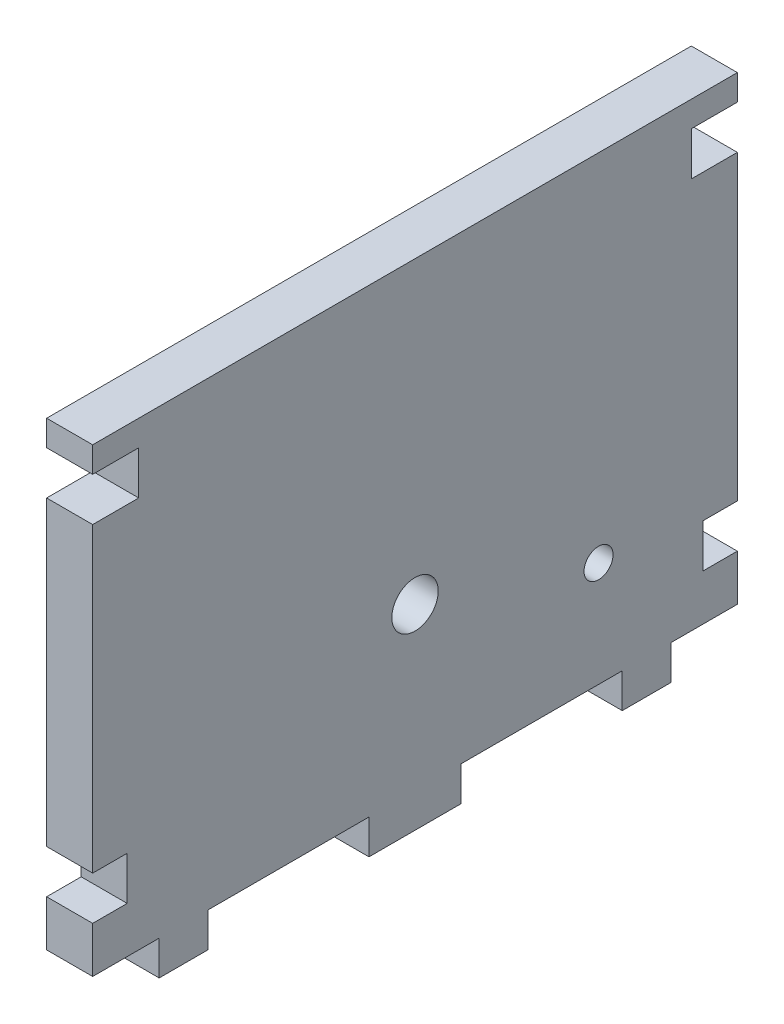
from build123d import *

# Parameters (mm, degrees)
SKETCH1_R           = 3.2004
SKETCH1_R_2         = 2
BOSS_EXTRUDE1_DEPTH = 6.35


with BuildPart() as part:
    # Sketch1 → Boss-Extrude1 (new body)
    with BuildSketch(Plane(origin=(0, 0, 0), x_dir=(0, 0, -1), z_dir=(1, 0, 0))):
        Polygon((28.575, -22.225), (28.575, -26.9875), (35.2806, -26.9875), (35.2806, -22.225), (44.45, -22.225), (44.45, -15.875), (39.6875, -15.875), (39.6875, -9.8806), (44.45, -9.8806), (44.45, 31.75), (38.1, 31.75), (38.1, 37.7444), (44.45, 37.7444), (44.45, 41.275), (-44.45, 41.275), (-44.45, 37.7444), (-38.1, 37.7444), (-38.1, 31.75), (-44.45, 31.75), (-44.45, 22.225), (-44.45, -9.8806), (-39.6875, -9.8806), (-39.6875, -15.875), (-44.45, -15.875), (-44.45, -22.225), (-35.2806, -22.225), (-35.2806, -26.9875), (-28.575, -26.9875), (-28.575, -22.225), (-6.35, -22.225), (-6.35, -26.9875), (6.35, -26.9875), (6.35, -22.225), align=None)
        Circle(SKETCH1_R, mode=Mode.SUBTRACT)
        with Locations((25.309068, -7.724902)):
            Circle(SKETCH1_R_2, mode=Mode.SUBTRACT)
    extrude(amount=BOSS_EXTRUDE1_DEPTH)


solid = part.part
